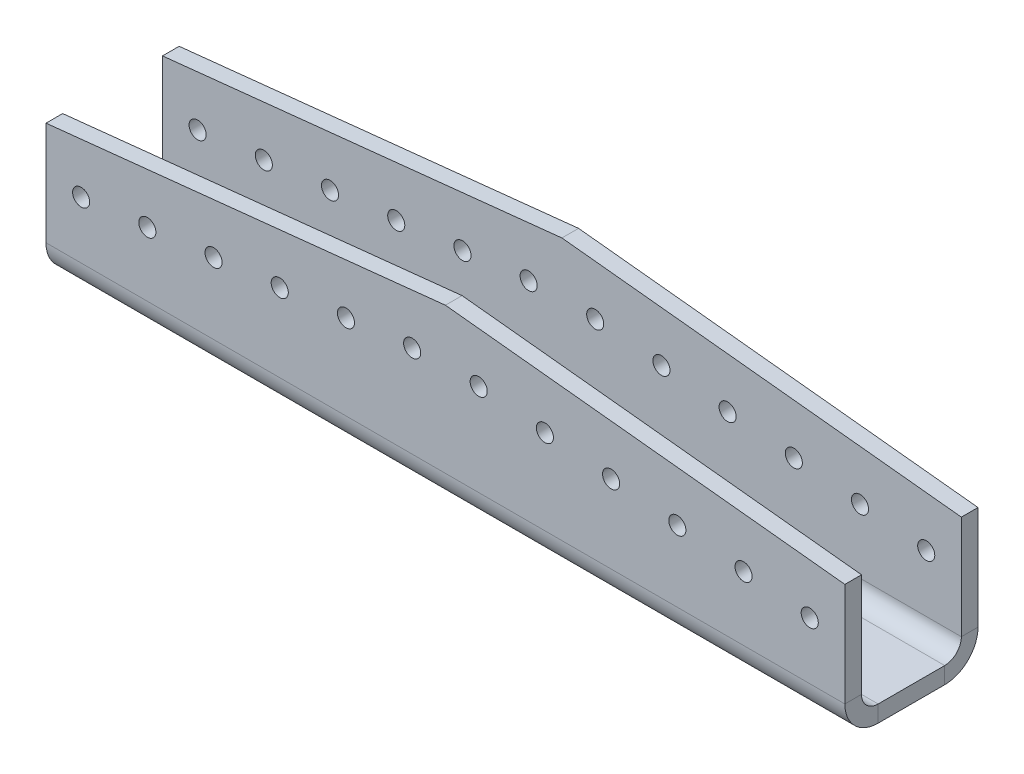
from build123d import *

# Parameters (mm, degrees)
SKETCH1_W                      = 152.4
SKETCH1_H                      = 19.05
BASE_FLANGE1_DEPTH             = 3.175
EDGE_FLANGE1_STRIP_W           = 19.05
EDGE_FLANGE1_STRIP_H           = 3.175
EDGE_FLANGE1_STRIP_CUT_DEPTH   = 152.4
EDGE_FLANGE1_STRIP_2_W         = 19.05
EDGE_FLANGE1_STRIP_2_H         = 3.175
EDGE_FLANGE1_STRIP_CUT_2_DEPTH = 152.4
EDGE_FLANGE1_DEPTH             = 152.4
EDGE_FLANGE1_BEND_DEPTH        = 152.4
CUT_EXTRUDE1_DEPTH             = 87.08071453
F_30_0_1285_DIAMETER_HOLE1_D   = 3.2639


# Sheet-metal steps are written as plain solids
with BuildPart() as part:
    # Sketch1 → Base-Flange1 (new body)
    with BuildSketch(Plane(origin=(0, 0, 0), x_dir=(1, 0, 0), z_dir=(0, 1, 0))):
        Rectangle(SKETCH1_W, SKETCH1_H)
    extrude(amount=-BASE_FLANGE1_DEPTH)

    # Edge-Flange1 strip (across the edge) → Edge-Flange1 strip cut (cut)
    with BuildSketch(Plane(origin=(-76.2, 0, 9.525), x_dir=(0, 0, -1), z_dir=(1, 0, 0))):
        with Locations((-6.35, -1.5875)):
            Rectangle(EDGE_FLANGE1_STRIP_W, EDGE_FLANGE1_STRIP_H)
    extrude(amount=EDGE_FLANGE1_STRIP_CUT_DEPTH, mode=Mode.SUBTRACT)

    # Edge-Flange1 strip 2 (across the edge) → Edge-Flange1 strip cut 2 (cut)
    with BuildSketch(Plane(origin=(76.2, 0, -9.525), x_dir=(0, 0, 1), z_dir=(-1, 0, 0))):
        with Locations((-6.35, -1.5875)):
            Rectangle(EDGE_FLANGE1_STRIP_2_W, EDGE_FLANGE1_STRIP_2_H)
    extrude(amount=EDGE_FLANGE1_STRIP_CUT_2_DEPTH, mode=Mode.SUBTRACT)

    # Edge-Flange1 section (across the edge) → Edge-Flange1 (add)
    with BuildSketch(Plane(origin=(-76.2, 0, 9.525), x_dir=(0, 0, -1), z_dir=(1, 0, 0))):
        with BuildLine():
            Line((-3.175, 3.175), (-3.175, 30.95625))
            Line((-3.175, 30.95625), (0, 30.95625))
            Line((0, 30.95625), (0, 3.175))
            ThreePointArc((0, 3.175), (0.92993597, 0.92993597), (3.175, 0))
            Line((3.175, 0), (3.175, -3.175))
            ThreePointArc((3.175, -3.175), (-1.315128061, -1.315128061), (-3.175, 3.175))
        make_face()
    extrude(amount=EDGE_FLANGE1_DEPTH)

    # Edge-Flange1 section 2 (across the edge) → Edge-Flange1 bend (add)
    with BuildSketch(Plane(origin=(76.2, 0, -9.525), x_dir=(0, 0, 1), z_dir=(-1, 0, 0))):
        with BuildLine():
            Line((-3.175, 3.175), (-3.175, 30.95625))
            Line((-3.175, 30.95625), (0, 30.95625))
            Line((0, 30.95625), (0, 3.175))
            ThreePointArc((0, 3.175), (0.92993597, 0.92993597), (3.175, 0))
            Line((3.175, 0), (3.175, -3.175))
            ThreePointArc((3.175, -3.175), (-1.315128061, -1.315128061), (-3.175, 3.175))
        make_face()
    extrude(amount=EDGE_FLANGE1_BEND_DEPTH)

    # Sketch12 → Cut-Extrude1 (cut, through all)
    with BuildSketch(Plane(origin=(0, 0, -12.7), x_dir=(-1, 0, 0), z_dir=(0, 0, -1))):
        Polygon((76.2, 30.95625), (0, 30.95625), (76.2, 22.935197368), align=None)
        Polygon((-76.2, 22.935197368), (0, 30.95625), (-76.2, 30.95625), align=None)
    extrude(amount=-CUT_EXTRUDE1_DEPTH, mode=Mode.SUBTRACT)

    # #30 (0.1285) Diameter Hole1 (through all)
    with Locations(Plane(origin=(0, 0, -12.7), x_dir=(-1, 0, 0), z_dir=(0, 0, -1))):
        with Locations((-69.498892921, 14.062952351), (-56.868673669, 15.392449114), (-44.238454417, 16.721945878), (-31.608235165, 18.051442641), (-18.978015912, 19.380939405), (-6.34779666, 20.710436168), (6.34779666, 20.710436168), (18.978015912, 19.380939405), (31.608235165, 18.051442641), (44.238454417, 16.721945878), (56.868673669, 15.392449114), (69.498892921, 14.062952351)):
            Hole(F_30_0_1285_DIAMETER_HOLE1_D / 2)


solid = part.part
